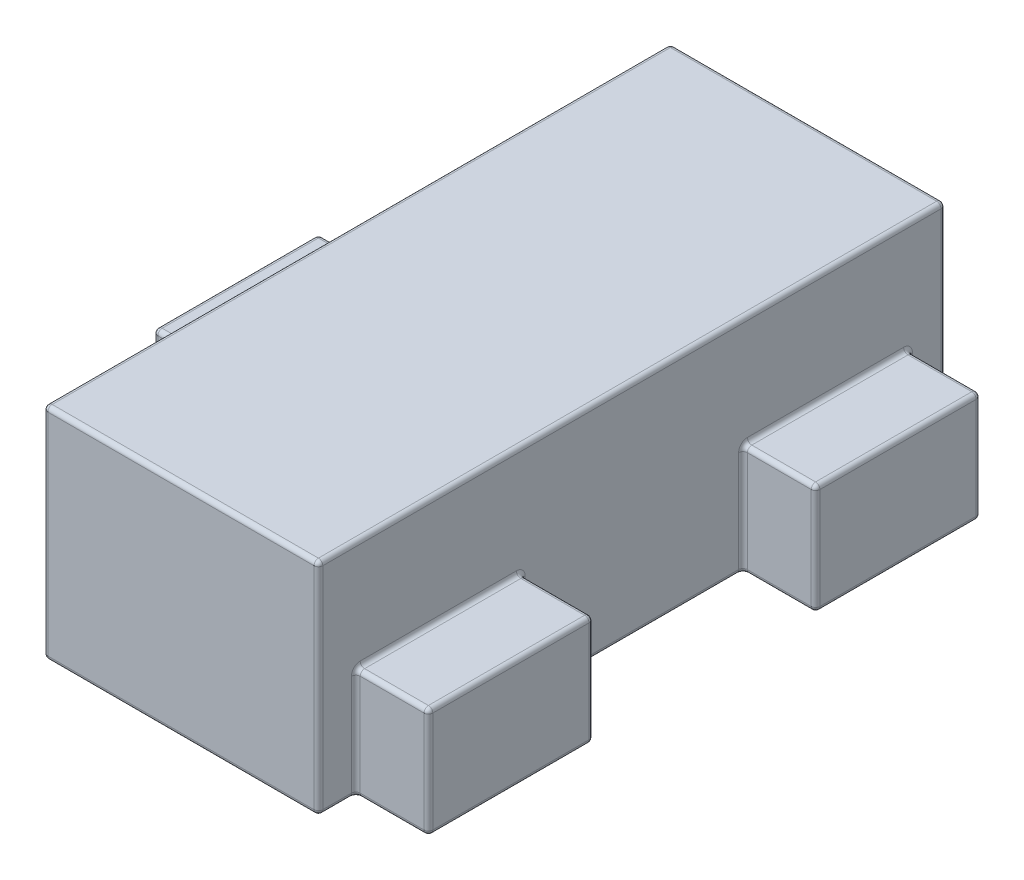
from build123d import *

# Parameters (mm, degrees)
SKETCH1_W           = 1.25
SKETCH1_H           = 2.85
BOSS_EXTRUDE1_DEPTH = 1
SKETCH2_W           = 0.55
SKETCH2_H           = 0.75
SKETCH2_W_2         = 0.33
BOSS_EXTRUDE2_DEPTH = 0.5
FILLET1_R           = 0.02


with BuildPart() as part:
    # Sketch1 → Boss-Extrude1 (new body)
    with BuildSketch(Plane(origin=(0, 0, 0), x_dir=(1, 0, 0), z_dir=(0, 1, 0))):
        Rectangle(SKETCH1_W, SKETCH1_H)
    extrude(amount=BOSS_EXTRUDE1_DEPTH)

    # Sketch2 → Boss-Extrude2 (add)
    with BuildSketch(Plane(origin=(0, 0, 0), x_dir=(1, 0, 0), z_dir=(0, 1, 0))):
        with Locations((-0.9, 0)):
            Rectangle(SKETCH2_W, SKETCH2_H)
        with Locations((0.79, 0.88)):
            Rectangle(SKETCH2_W_2, SKETCH2_H)
        with Locations((0.79, -0.88)):
            Rectangle(SKETCH2_W_2, SKETCH2_H)
    extrude(amount=BOSS_EXTRUDE2_DEPTH)

    # Fillet1
    fillet1_edges = [part.edges().sort_by_distance(p)[0] for p in [
        (-0.625, 0.25, 0.375),
        (-0.625, 0.25, -0.375),
        (-1.175, 0.25, -0.375),
        (-1.175, 0.25, 0.375),
        (0, 1, 1.425),
        (-0.625, 1, 0),
        (0.79, 0, 0.505),
        (0.79, 0, -1.255),
        (-0.625, 0, -0.9),
        (-0.9, 0, -0.375),
        (-1.175, 0, 0),
        (-0.9, 0, 0.375),
        (-0.625, 0, 0.9),
        (0, 0, 1.425),
        (0.625, 0, 1.34),
        (0.625, 0.5, 1.425),
        (0.625, 1, 0),
        (0.625, 0, -1.34),
        (0.625, 0.25, -1.255),
        (0.625, 0, 0),
        (0.625, 0.25, 0.505),
        (-0.625, 0.5, 0),
        (-0.9, 0.5, 0.375),
        (-1.175, 0.5, 0),
        (-0.9, 0.5, -0.375),
        (0.625, 0.5, -1.425),
        (0, 1, -1.425),
        (-0.625, 0.5, -1.425),
        (0, 0, -1.425),
        (0.79, 0.5, -1.255),
        (0.625, 0.5, -0.88),
        (0.79, 0.5, 0.505),
        (0.625, 0.5, 0.88),
        (0.625, 0.25, -0.505),
        (0.79, 0.5, -0.505),
        (0.79, 0, -0.505),
        (0.955, 0.25, -0.505),
        (0.955, 0.5, -0.88),
        (0.955, 0.25, -1.255),
        (0.955, 0, -0.88),
        (0.625, 0.25, 1.255),
        (0.79, 0.5, 1.255),
        (0.79, 0, 1.255),
        (0.955, 0.25, 1.255),
        (0.955, 0.5, 0.88),
        (0.955, 0.25, 0.505),
        (0.955, 0, 0.88),
        (-0.625, 0.5, 1.425),
    ]]
    fillet(fillet1_edges, radius=FILLET1_R)


solid = part.part
